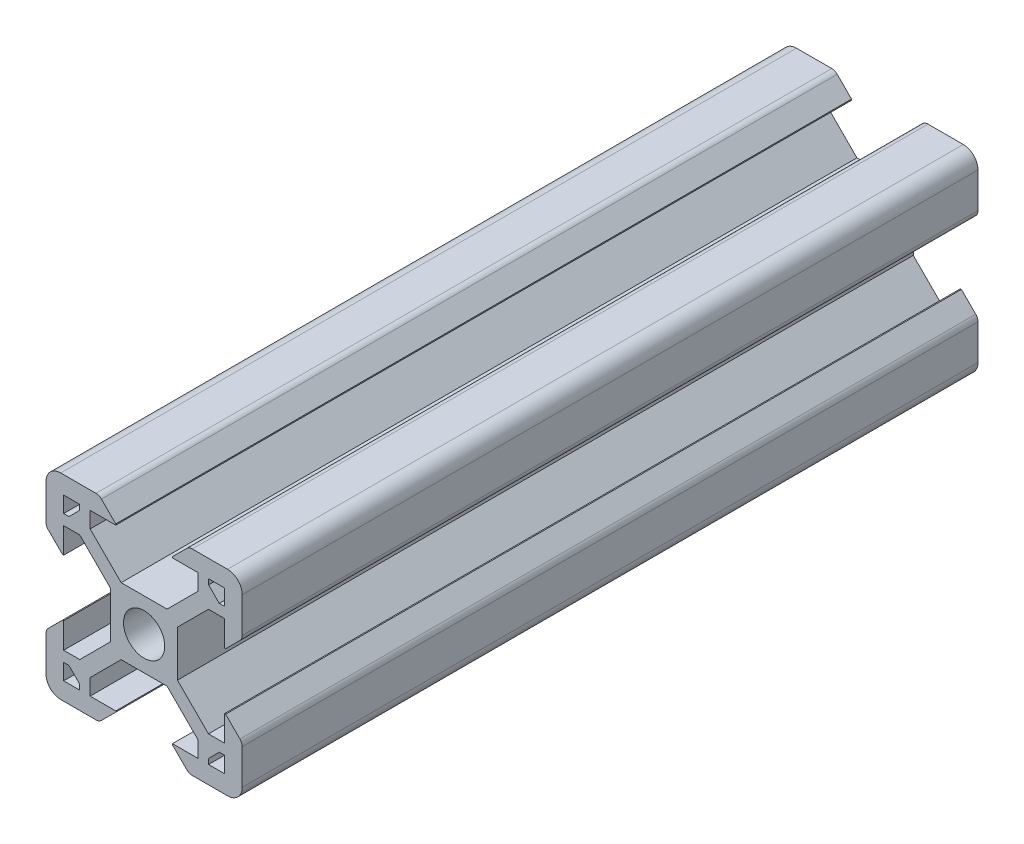
from build123d import *

# Parameters (mm, degrees)
SKETCH6_R           = 2.1
BOSS_EXTRUDE1_DEPTH = 75


with BuildPart() as part:
    # Sketch6 → Boss-Extrude1 (new body)
    with BuildSketch(Plane.XY):
        with BuildLine():
            Line((-3.4, -2.339339828), (-3.4, 2.339339828))
            Line((-3.4, 2.339339828), (-6.560660172, 5.5))
            Line((-6.560660172, 5.5), (-8.2, 5.5))
            Line((-8.2, 5.5), (-8.2, 2.89))
            Line((-8.2, 2.89), (-8.31, 2.89))
            Line((-8.31, 2.89), (-9.768614357, 4.348614357))
            ThreePointArc((-9.768614357, 4.348614357), (-9.939864831, 4.604908803), (-10, 4.907228714))
            Line((-10, 4.907228714), (-10, 8.5))
            ThreePointArc((-10, 8.5), (-9.560660172, 9.560660172), (-8.5, 10))
            Line((-8.5, 10), (-4.907228714, 10))
            ThreePointArc((-4.907228714, 10), (-4.604908803, 9.939864831), (-4.348614357, 9.768614357))
            Line((-4.348614357, 9.768614357), (-2.89, 8.31))
            Line((-2.89, 8.31), (-2.89, 8.2))
            Line((-2.89, 8.2), (-5.5, 8.2))
            Line((-5.5, 8.2), (-5.5, 6.560660172))
            Line((-5.5, 6.560660172), (-2.339339828, 3.4))
            Line((-2.339339828, 3.4), (2.339339828, 3.4))
            Line((2.339339828, 3.4), (5.5, 6.560660172))
            Line((5.5, 6.560660172), (5.5, 8.2))
            Line((5.5, 8.2), (2.89, 8.2))
            Line((2.89, 8.2), (2.89, 8.31))
            Line((2.89, 8.31), (4.348614357, 9.768614357))
            ThreePointArc((4.348614357, 9.768614357), (4.604908803, 9.939864831), (4.907228714, 10))
            Line((4.907228714, 10), (8.5, 10))
            ThreePointArc((8.5, 10), (9.560660172, 9.560660172), (10, 8.5))
            Line((10, 8.5), (10, 4.907228714))
            ThreePointArc((10, 4.907228714), (9.939864831, 4.604908803), (9.768614357, 4.348614357))
            Line((9.768614357, 4.348614357), (8.31, 2.89))
            Line((8.31, 2.89), (8.2, 2.89))
            Line((8.2, 2.89), (8.2, 5.5))
            Line((8.2, 5.5), (6.560660172, 5.5))
            Line((6.560660172, 5.5), (3.4, 2.339339828))
            Line((3.4, 2.339339828), (3.4, -2.339339828))
            Line((3.4, -2.339339828), (6.560660172, -5.5))
            Line((6.560660172, -5.5), (8.2, -5.5))
            Line((8.2, -5.5), (8.2, -2.89))
            Line((8.2, -2.89), (8.31, -2.89))
            Line((8.31, -2.89), (9.768614357, -4.348614357))
            ThreePointArc((9.768614357, -4.348614357), (9.939864831, -4.604908803), (10, -4.907228714))
            Line((10, -4.907228714), (10, -8.5))
            ThreePointArc((10, -8.5), (9.560660172, -9.560660172), (8.5, -10))
            Line((8.5, -10), (4.907228714, -10))
            ThreePointArc((4.907228714, -10), (4.604908803, -9.939864831), (4.348614357, -9.768614357))
            Line((4.348614357, -9.768614357), (2.89, -8.31))
            Line((2.89, -8.31), (2.89, -8.2))
            Line((2.89, -8.2), (5.5, -8.2))
            Line((5.5, -8.2), (5.5, -6.560660172))
            Line((5.5, -6.560660172), (2.339339828, -3.4))
            Line((2.339339828, -3.4), (-2.339339828, -3.4))
            Line((-2.339339828, -3.4), (-5.5, -6.560660172))
            Line((-5.5, -6.560660172), (-5.5, -8.2))
            Line((-5.5, -8.2), (-2.89, -8.2))
            Line((-2.89, -8.2), (-2.89, -8.31))
            Line((-2.89, -8.31), (-4.348614357, -9.768614357))
            ThreePointArc((-4.348614357, -9.768614357), (-4.604908803, -9.939864831), (-4.907228714, -10))
            Line((-4.907228714, -10), (-8.5, -10))
            ThreePointArc((-8.5, -10), (-9.560660172, -9.560660172), (-10, -8.5))
            Line((-10, -8.5), (-10, -4.907228714))
            ThreePointArc((-10, -4.907228714), (-9.939864831, -4.604908803), (-9.768614357, -4.348614357))
            Line((-9.768614357, -4.348614357), (-8.31, -2.89))
            Line((-8.31, -2.89), (-8.2, -2.89))
            Line((-8.2, -2.89), (-8.2, -5.5))
            Line((-8.2, -5.5), (-6.560660172, -5.5))
            Line((-6.560660172, -5.5), (-3.4, -2.339339828))
        make_face()
        Circle(SKETCH6_R, mode=Mode.SUBTRACT)
        Polygon((-7.66, 6.57), (-6.57, 7.66), (-6.57, 8.2), (-8.2, 8.2), (-8.2, 6.57), align=None, mode=Mode.SUBTRACT)
        Polygon((8.2, 6.57), (7.66, 6.57), (6.57, 7.66), (6.57, 8.2), (8.2, 8.2), align=None, mode=Mode.SUBTRACT)
        Polygon((7.66, -6.57), (6.57, -7.66), (6.57, -8.2), (8.2, -8.2), (8.2, -6.57), align=None, mode=Mode.SUBTRACT)
        Polygon((-8.2, -6.57), (-7.66, -6.57), (-6.57, -7.66), (-6.57, -8.2), (-8.2, -8.2), align=None, mode=Mode.SUBTRACT)
    extrude(amount=-BOSS_EXTRUDE1_DEPTH)


solid = part.part
